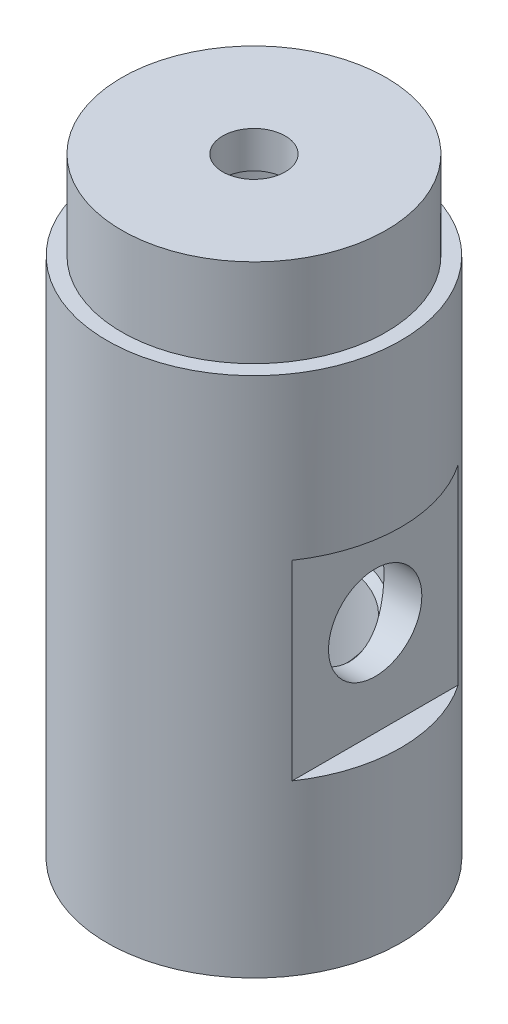
from build123d import *

# Parameters (mm, degrees)
SCHIZZO4_W               = 26
SCHIZZO4_H               = 26
TAGLIO_ESTRUSIONE1_DEPTH = 3.5
SCHIZZO5_R               = 6.35
TAGLIO_ESTRUSIONE2_DEPTH = 9
TAGLIO_ESTRUSIONE3_START = -9
SCHIZZO6_R               = 6.35
TAGLIO_ESTRUSIONE3_DEPTH = 9
SMUSSO1_SIZE             = 1


with BuildPart() as part:
    # Schizzo1 → Rivoluzione1 (revolve)
    with BuildSketch(Plane.XY):
        Polygon((-12, 0), (-20, 0), (-20, 71), (-18, 71), (-18, 83), (-4.25, 83), (-4.25, 78), (-12, 78), align=None)
    revolve(axis=Axis((0, 0, 0), (0, 1, 0)))

    # Schizzo4 → Taglio-Estrusione1 (cut)
    with BuildSketch(Plane(origin=(20, 0, 0), x_dir=(0, 0, -1), z_dir=(1, 0, 0))):
        with Locations((0, 36)):
            Rectangle(SCHIZZO4_W, SCHIZZO4_H)
    taglio_estrusione1 = extrude(amount=-TAGLIO_ESTRUSIONE1_DEPTH, mode=Mode.SUBTRACT)

    # Schizzo5 → Taglio-Estrusione2 (cut)
    with BuildSketch(Plane(origin=(16.5, 0, 0), x_dir=(0, 0, -1), z_dir=(1, 0, 0))):
        with Locations((0, 36)):
            Circle(SCHIZZO5_R)
    extrude(amount=-TAGLIO_ESTRUSIONE2_DEPTH, mode=Mode.SUBTRACT)

    # Specchia1: Taglio-Estrusione1 across plane
    add(taglio_estrusione1.mirror(Plane(origin=(0, 0, 0), x_dir=(0, 0, 1), z_dir=(1, 0, 0))), mode=Mode.SUBTRACT)

    # Schizzo6 → Taglio-Estrusione3 (cut)
    with BuildSketch(Plane.ZY.offset(16.5).offset(TAGLIO_ESTRUSIONE3_START)):
        with Locations((0, 36)):
            Circle(SCHIZZO6_R)
    extrude(amount=TAGLIO_ESTRUSIONE3_DEPTH, mode=Mode.SUBTRACT)

    # Schizzo7 → Taglia-Rivoluzione3 (revolve, cut)
    with BuildSketch(Plane.XY):
        Polygon((-12, 43.35), (-13, 42.35), (-13, 29.65), (-12, 28.65), align=None)
    revolve(axis=Axis((0, 0, 0), (0, 1, 0)), mode=Mode.SUBTRACT)

    # Smusso1
    smusso1_edges = [part.edges().sort_by_distance(p)[0] for p in [
        (12, 0, 0),
    ]]
    chamfer(smusso1_edges, length=SMUSSO1_SIZE)


solid = part.part
